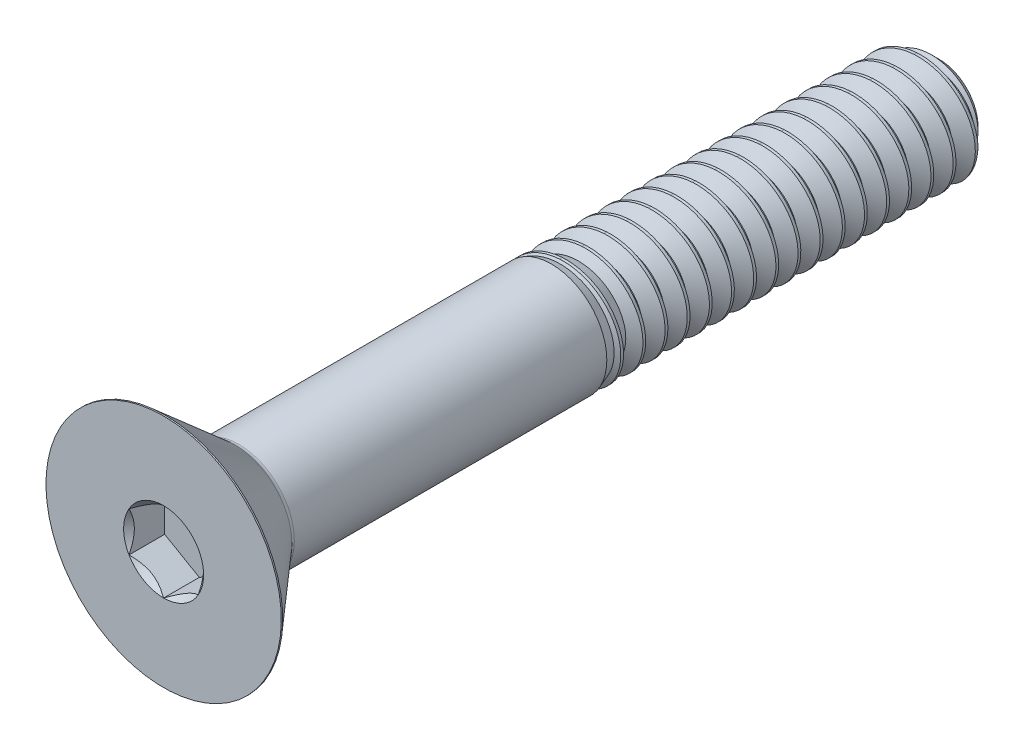
from build123d import *

# Parameters (mm, degrees)
SKETCH10_R         = 2.291358881
CUT_EXTRUDE2_DEPTH = 2.0447
CUT_EXTRUDE2_DRAFT = -45
CUT_EXTRUDE1_DEPTH = 2.0447
CUT_SWEEP3_PITCH   = 1.27
CUT_SWEEP3_TO      = 22.225


with BuildPart() as part:
    # Sketch2 → Revolve1 (revolve)
    with BuildSketch(Plane(origin=(0, 0, 0), x_dir=(0, 0, -1), z_dir=(1, 0, 0))):
        with BuildLine():
            Line((-22.143212, 6.7437), (-18.1356, 3.259936038))
            ThreePointArc((-18.1356, 3.259936038), (-18.029693592, 3.196928347), (-17.908428247, 3.175))
            Line((-17.908428247, 3.175), (21.2725, 3.175))
            Line((21.2725, 3.175), (22.225, 2.2225))
            Line((22.225, 2.2225), (22.225, 0))
            Line((22.225, 0), (-22.225, 0))
            Line((-22.225, 0), (-22.225, 6.7437))
            Line((-22.225, 6.7437), (-22.143212, 6.7437))
        make_face()
    revolve(axis=Axis((0, 0, -22.225), (0, 0, 1)))


with BuildPart() as cut_extrude2_tool:
    # Sketch10 → Cut-Extrude2 (with draft: the straight prism first)
    with BuildSketch(Plane.XY.offset(22.225)):
        Circle(SKETCH10_R)
    extrude(amount=-CUT_EXTRUDE2_DEPTH)
    # Cut-Extrude2: the draft: its side faces are tilted about the plane it starts from
    cut_extrude2_sides = [cut_extrude2_tool.faces().sort_by_distance(p)[0] for p in [
        (-2.291358881, 0, 21.20265),
    ]]
    draft(cut_extrude2_sides, Plane.XY.offset(22.225), CUT_EXTRUDE2_DRAFT)


with BuildPart() as part_1:
    add(part.part)

    # Cut-Extrude2: cut by cut_extrude2_tool
    add(cut_extrude2_tool.part, mode=Mode.SUBTRACT)

    # Sketch9 → Cut-Extrude1 (cut)
    with BuildSketch(Plane.XY.offset(22.225)):
        Polygon((1.984375, -1.14567944), (1.984375, 1.14567944), (0, 2.291358881), (-1.984375, 1.14567944), (-1.984375, -1.14567944), (0, -2.291358881), align=None)
    extrude(amount=-CUT_EXTRUDE1_DEPTH, mode=Mode.SUBTRACT)


with BuildPart() as body_2:
    # Split1: the piece on the far side of the plane
    add(part_1.part)
    split(bisect_by=Plane.XY, keep=Keep.BOTTOM)

    # Cut-Sweep3: arcs per turn and ends read off the stored shape
    # Cut-Sweep3: the profile of Sketch4 screwed along a right-hand helix through 18.5 turns, 8 arcs to a turn; built about Z, then put on its axis
    cut_sweep3_z = Axis((0, 0, 0), (0, 0, 1))
    cut_sweep3_corners = [(3.243740766, 0, 0.0396875), (3.243740766, 0, -1.1509375), (2.350110803, 0, -0.635), (2.350110803, 0, -0.47625)]
    with BuildLine(mode=Mode.PRIVATE) as cut_sweep3_profile:
        Line(cut_sweep3_corners[0], cut_sweep3_corners[1])
        Line(cut_sweep3_corners[1], cut_sweep3_corners[2])
        Line(cut_sweep3_corners[2], cut_sweep3_corners[3])
        Line(cut_sweep3_corners[3], cut_sweep3_corners[0])
    cut_sweep3_cap = Face(cut_sweep3_profile.wire())
    cut_sweep3_turn_angles = [0, 22.5, 45, 67.5, 90, 112.5, 135, 157.5, 180, 202.5, 225, 247.5, 270, 292.5, 315, 337.5, 360]
    cut_sweep3_turn_weights = [1, 0.9238795325112867, 1, 0.9238795325112867, 1, 0.9238795325112867, 1, 0.9238795325112867, 1, 0.9238795325112867, 1, 0.9238795325112867, 1, 0.9238795325112867, 1, 0.9238795325112867, 1]
    cut_sweep3_turn_rails = [Edge.make_bspline([Vector(p[0], p[1], 0).rotate(cut_sweep3_z, cut_sweep3_turn_angles[k]) / cut_sweep3_turn_weights[k] + Vector(0, 0, p[2] + CUT_SWEEP3_PITCH * cut_sweep3_turn_angles[k] / 360) for k in range(17)], [0, 0, 0, 1, 1, 2, 2, 3, 3, 4, 4, 5, 5, 6, 6, 7, 7, 8, 8, 8], 2, cut_sweep3_turn_weights) for p in cut_sweep3_corners]
    cut_sweep3_turn_sides = [Face.make_surface_from_curves(cut_sweep3_turn_rails[p[0]], cut_sweep3_turn_rails[p[1]]) for p in [(0, 1), (1, 2), (2, 3), (3, 0)]]
    cut_sweep3_last_angles = [6480, 6502.5, 6525, 6547.5, 6570, 6592.5, 6615, 6637.5, 6660]
    cut_sweep3_last_weights = [1, 0.9238795325112867, 1, 0.9238795325112867, 1, 0.9238795325112867, 1, 0.9238795325111987, 1]
    cut_sweep3_last_rails = [Edge.make_bspline([Vector(p[0], p[1], 0).rotate(cut_sweep3_z, cut_sweep3_last_angles[k]) / cut_sweep3_last_weights[k] + Vector(0, 0, p[2] + CUT_SWEEP3_PITCH * cut_sweep3_last_angles[k] / 360) for k in range(9)], [0, 0, 0, 1, 1, 2, 2, 3, 3, 4, 4, 4], 2, cut_sweep3_last_weights) for p in cut_sweep3_corners]
    cut_sweep3_last_sides = [Face.make_surface_from_curves(cut_sweep3_last_rails[p[0]], cut_sweep3_last_rails[p[1]]) for p in [(0, 1), (1, 2), (2, 3), (3, 0)]]
    cut_sweep3 = Plane(origin=(0, 0, -22.225), x_dir=(0, 1, 0), z_dir=(0, 0, 1)) * split(Solid(Shell([*[p.moved(Location((0, 0, CUT_SWEEP3_PITCH * i))) for i in range(18) for p in cut_sweep3_turn_sides], *cut_sweep3_last_sides, cut_sweep3_cap, cut_sweep3_cap.rotate(cut_sweep3_z, 6660).moved(Location((0, 0, CUT_SWEEP3_PITCH * 6660 / 360)))])), bisect_by=Plane.XY.offset(CUT_SWEEP3_TO), keep=Keep.BOTTOM, mode=Mode.PRIVATE)
    add(cut_sweep3, mode=Mode.SUBTRACT)


with BuildPart() as part_2:
    add(part_1.part)

    # Split1
    split(bisect_by=Plane.XY, keep=Keep.TOP)

    add(body_2.part)  # Boss-Extrude1 merges body 2
    # Boss-Extrude1 cone 1 section (through the dimple's axis) → Boss-Extrude1 (revolve)
    with BuildSketch(Plane(origin=(0, 0, 0), x_dir=(0, -1, 0), z_dir=(1, 0, 0))):
        Polygon((0, 0), (3.175, 0), (0, 8.723240807), align=None)
    revolve(axis=Axis((0, 0, 0), (0, 0, -1)))


solid = part_2.part
